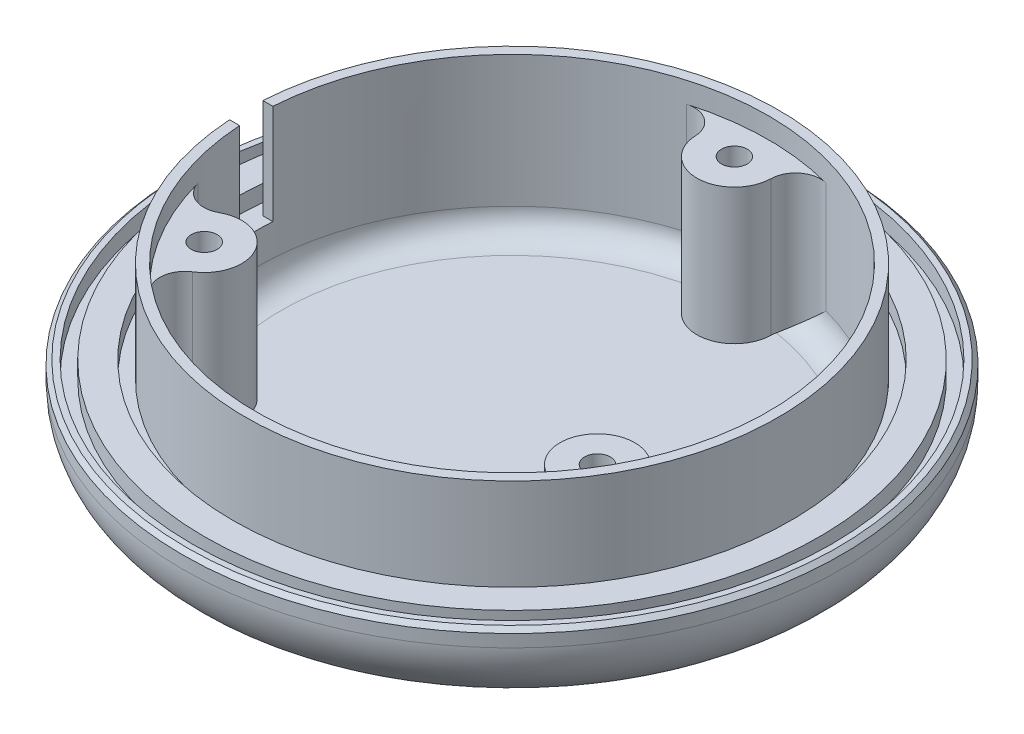
from build123d import *

# Parameters (mm, degrees)
ESQUISSE2_R             = 2.75
ESQUISSE3_W             = 4
ESQUISSE3_H             = 13.976787535
ENL_V_MAT_EXTRU_1_DEPTH = 32
ESQUISSE4_R             = 1.55
BOSS_EXTRU_1_DEPTH      = 16.3
CONG_1_START            = 1.2
CONG_1_2_OUTLINE_R      = 1.55
CONG_1_2_DEPTH          = 16.3
CONG_1_3_DEPTH          = 16.3
CHANFREIN1_SIZE         = 0.5


with BuildPart() as part:
    # Esquisse2 → Révolution1 (revolve)
    with BuildSketch(Plane.XY, mode=Mode.PRIVATE) as r_volution1_sk:
        with BuildLine():
            Line((-39.6, 8), (-39.6, 10))
            Line((-39.6, 10), (-38.4, 10))
            Line((-38.4, 10), (-38.4, 8))
            Line((-38.4, 8), (-36.9, 8))
            Line((-36.9, 8), (-36.9, 10))
            Line((-36.9, 10), (-33.5, 10))
            Line((-33.5, 10), (-33.5, 8))
            Line((-33.5, 8), (-32, 8))
            Line((-32, 8), (-32, 20))
            Line((-32, 20), (-30.8, 20))
            Line((-30.8, 20), (-30.8, 1.2))
            Line((-30.8, 1.2), (0, 1.2))
            Line((0, 1.2), (0, 0))
            Line((0, 0), (-32, 0))
            ThreePointArc((-32, 0), (-37.397100726, 2.48275431), (-39.6, 8))
        make_face()
        with Locations((-34.3, 4.5)):
            Circle(ESQUISSE2_R, mode=Mode.SUBTRACT)
    revolve(r_volution1_sk.sketch.rotate(Axis((0, 24.412434583, 0), (0, -1, 0)), 270), axis=Axis((0, 24.412434583, 0), (0, -1, 0)))

    # Esquisse3 → Enlèv. mat.-Extru.1 (cut)
    with BuildSketch(Plane(origin=(0, 0, 0), x_dir=(0, 0, -1), z_dir=(1, 0, 0))):
        with Locations((0, 14.988393767)):
            Rectangle(ESQUISSE3_W, ESQUISSE3_H)
    extrude(amount=-ENL_V_MAT_EXTRU_1_DEPTH, mode=Mode.SUBTRACT)

    # Esquisse4 → Boss.-Extru.1 (add)
    # profile 1 of 3: a face of its own
    with BuildSketch(Plane(origin=(0, 1.2, 0), x_dir=(1, 0, 0), z_dir=(0, 1, 0))):
        with BuildLine():
            Line((4.221484661, 26.998563466), (4.221484661, 30.649243024))
            ThreePointArc((4.221484661, 30.649243024), (-0.281509243, 30.937320233), (-4.778515339, 30.56734895))
            Line((-4.778515339, 30.56734895), (-4.778515339, 26.998563466))
            ThreePointArc((-4.778515339, 26.998563466), (-0.278515339, 22.498563466), (4.221484661, 26.998563466))
        make_face()
        with Locations(Location((-0.278515339, 26.998563466, 0), (0, 0, 270))):
            Circle(ESQUISSE4_R, mode=Mode.SUBTRACT)
    # profile 2 of 3: a face of its own
    with BuildSketch(Plane(origin=(0, 1.2, 0), x_dir=(1, 0, 0), z_dir=(0, 1, 0))):
        with BuildLine():
            Line((21.270699496, -17.155194691), (24.432280735, -18.98053447))
            ThreePointArc((24.432280735, -18.98053447), (26.933259869, -15.224865961), (28.861358387, -11.145358799))
            Line((28.861358387, -11.145358799), (25.770699496, -9.360966057))
            ThreePointArc((25.770699496, -9.360966057), (19.623585179, -11.008080374), (21.270699496, -17.155194691))
        make_face()
        with Locations(Location((23.520699496, -13.258080374, 0), (0, 0, 270))):
            Circle(ESQUISSE4_R, mode=Mode.SUBTRACT)
    # profile 3 of 3: a face of its own
    with BuildSketch(Plane(origin=(0, 1.2, 0), x_dir=(1, 0, 0), z_dir=(0, 1, 0))):
        with BuildLine():
            Line((-25.492184157, -9.843368775), (-28.653765396, -11.668708554))
            ThreePointArc((-28.653765396, -11.668708554), (-26.651750626, -15.712454273), (-24.082843047, -19.421990151))
            Line((-24.082843047, -19.421990151), (-20.992184157, -17.637597409))
            ThreePointArc((-20.992184157, -17.637597409), (-19.34506984, -11.490483092), (-25.492184157, -9.843368775))
        make_face()
        with Locations(Location((-23.242184157, -13.740483092, 0), (0, 0, 270))):
            Circle(ESQUISSE4_R, mode=Mode.SUBTRACT)
    extrude(amount=BOSS_EXTRU_1_DEPTH)

    # Congé1: read off the stored shape, not the designer's step
    # Congé1 outline → Congé1 (revolve)
    with BuildSketch(Plane.XY):
        with BuildLine():
            ThreePointArc((30.8, 4.2), (29.921320344, 2.078679656), (27.8, 1.2))
            Line((27.8, 1.2), (30.8, 1.2))
            Line((30.8, 1.2), (30.8, 4.2))
        make_face()
    revolve(axis=Axis((0, 0, 0), (0, 1, 0)))

    # Cong_1 2 outline → Cong_1 2 (cut)
    with BuildSketch(Plane(origin=(0, 0, 0), x_dir=(1, 0, 0), z_dir=(0, 1, 0)).offset(CONG_1_START)):
        with Locations((23.520699496, -13.258080374)):
            Circle(CONG_1_2_OUTLINE_R)
        with Locations((-0.278515339, 26.998563466)):
            Circle(CONG_1_2_OUTLINE_R)
        with Locations((-23.242184157, -13.740483092)):
            Circle(CONG_1_2_OUTLINE_R)
    extrude(amount=CONG_1_2_DEPTH, mode=Mode.SUBTRACT)

    # Cong_1 3 outline → Cong_1 3 (add)
    with BuildSketch(Plane(origin=(0, 0, 0), x_dir=(1, 0, 0), z_dir=(0, 1, 0)).offset(CONG_1_START)):
        with BuildLine():
            ThreePointArc((-21.304455292, -22.243205361), (-22.214465604, -19.778228467), (-20.834481269, -17.542188867))
            ThreePointArc((-20.834481269, -17.542188867), (-20.912844176, -17.590700651), (-20.992184157, -17.637597409))
            Line((-20.992184157, -17.637597409), (-23.961346562, -19.351844122))
            ThreePointArc((-23.961346562, -19.351844122), (-22.679025482, -20.839908905), (-21.304455292, -22.243205361))
        make_face()
        with BuildLine():
            ThreePointArc((-25.492184157, -9.843368775), (-25.452452065, -9.820697923), (-25.412491568, -9.798432136))
            ThreePointArc((-25.412491568, -9.798432136), (-28.036801715, -9.929680405), (-29.757855604, -7.944182139))
            ThreePointArc((-29.757855604, -7.944182139), (-29.202450702, -9.790652326), (-28.532595037, -11.598750815))
            Line((-28.532595037, -11.598750815), (-25.492184157, -9.843368775))
        make_face()
        with BuildLine():
            ThreePointArc((21.19193693, -17.108647204), (22.61775634, -19.315742323), (21.758791347, -21.798967846))
            ThreePointArc((21.758791347, -21.798967846), (23.080178985, -20.394737998), (24.311110376, -18.910576731))
            Line((24.311110376, -18.910576731), (21.270699496, -17.155194691))
            ThreePointArc((21.270699496, -17.155194691), (21.231199916, -17.132121116), (21.19193693, -17.108647204))
        make_face()
        with BuildLine():
            ThreePointArc((-4.778515339, 30.427056893), (-6.708377783, 30.060566653), (-8.610953258, 29.571802177))
            ThreePointArc((-8.610953258, 29.571802177), (-6.021215492, 29.127405778), (-4.774740562, 26.814284487))
            ThreePointArc((-4.774740562, 26.814284487), (-4.777571546, 26.906404648), (-4.778515339, 26.998563466))
            Line((-4.778515339, 26.998563466), (-4.778515339, 30.427056893))
        make_face()
        with BuildLine():
            ThreePointArc((29.91540855, -7.328596816), (28.235681096, -9.349177311), (25.609221831, -9.27209562))
            ThreePointArc((25.609221831, -9.27209562), (25.690415722, -9.315703997), (25.770699496, -9.360966057))
            Line((25.770699496, -9.360966057), (28.739861901, -11.07521277))
            ThreePointArc((28.739861901, -11.07521277), (29.387403266, -9.220657748), (29.91540855, -7.328596816))
        make_face()
        with BuildLine():
            ThreePointArc((4.221484661, 26.998563466), (4.221252149, 26.952819039), (4.220554638, 26.907079339))
            ThreePointArc((4.220554638, 26.907079339), (5.419045375, 29.245422728), (7.999064257, 29.743149985))
            ThreePointArc((7.999064257, 29.743149985), (6.122271717, 30.185390324), (4.221484661, 30.509327545))
            Line((4.221484661, 30.509327545), (4.221484661, 26.998563466))
        make_face()
    extrude(amount=CONG_1_3_DEPTH)

    # Chanfrein1
    chanfrein1_edges = [part.edges().sort_by_distance(p)[0] for p in [
        (0, 10, -39.6),
    ]]
    chamfer(chanfrein1_edges, length=CHANFREIN1_SIZE)


solid = part.part
